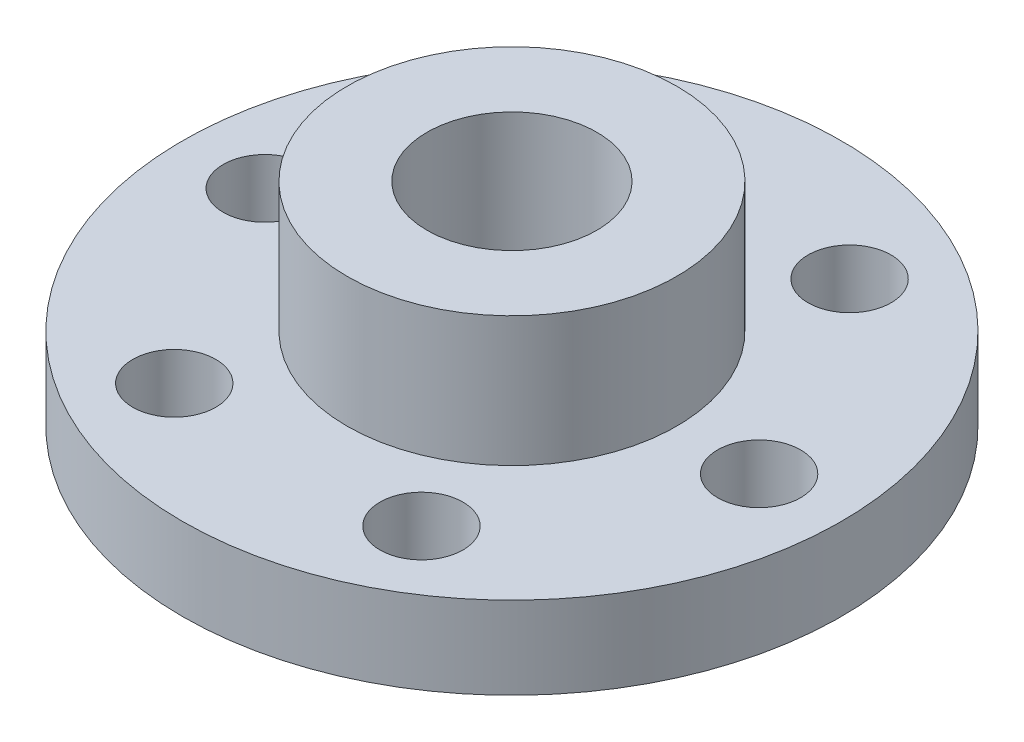
from build123d import *

# Parameters (mm, degrees)
SKETCH1_R            = 25.4
SKETCH1_R_2          = 4.826
MAIN_BODY_DEPTH      = 6.35
SKETCH2_R            = 12.7
SKETCH2_R_2          = 6.5484375
TAP_BOSS_DEPTH       = 10.000000066
M6_CLEARANCE_HOLE1_D = 6.4


with BuildPart() as part:
    # Sketch1 → main body (new body)
    with BuildSketch(Plane(origin=(0, 0, 0), x_dir=(1, 0, 0), z_dir=(0, 1, 0))):
        Circle(SKETCH1_R)
        Circle(SKETCH1_R_2, mode=Mode.SUBTRACT)
    extrude(amount=MAIN_BODY_DEPTH)

    # Sketch2 → tap boss (add)
    with BuildSketch(Plane(origin=(0, 6.35, 0), x_dir=(1, 0, 0), z_dir=(0, 1, 0))):
        Circle(SKETCH2_R)
        Circle(SKETCH2_R_2, mode=Mode.SUBTRACT)
    extrude(amount=TAP_BOSS_DEPTH)

    # M6 Clearance Hole1 (through all)
    with Locations(Plane(origin=(0, 6.35, 0), x_dir=(1, 0, 0), z_dir=(0, 1, 0))):
        with Locations((-19.05, 0), (-9.525, 16.497783942), (9.525, 16.497783942), (19.05, 0), (9.525, -16.497783942), (-9.525, -16.497783942), (0, 0)):
            Hole(M6_CLEARANCE_HOLE1_D / 2)


solid = part.part
